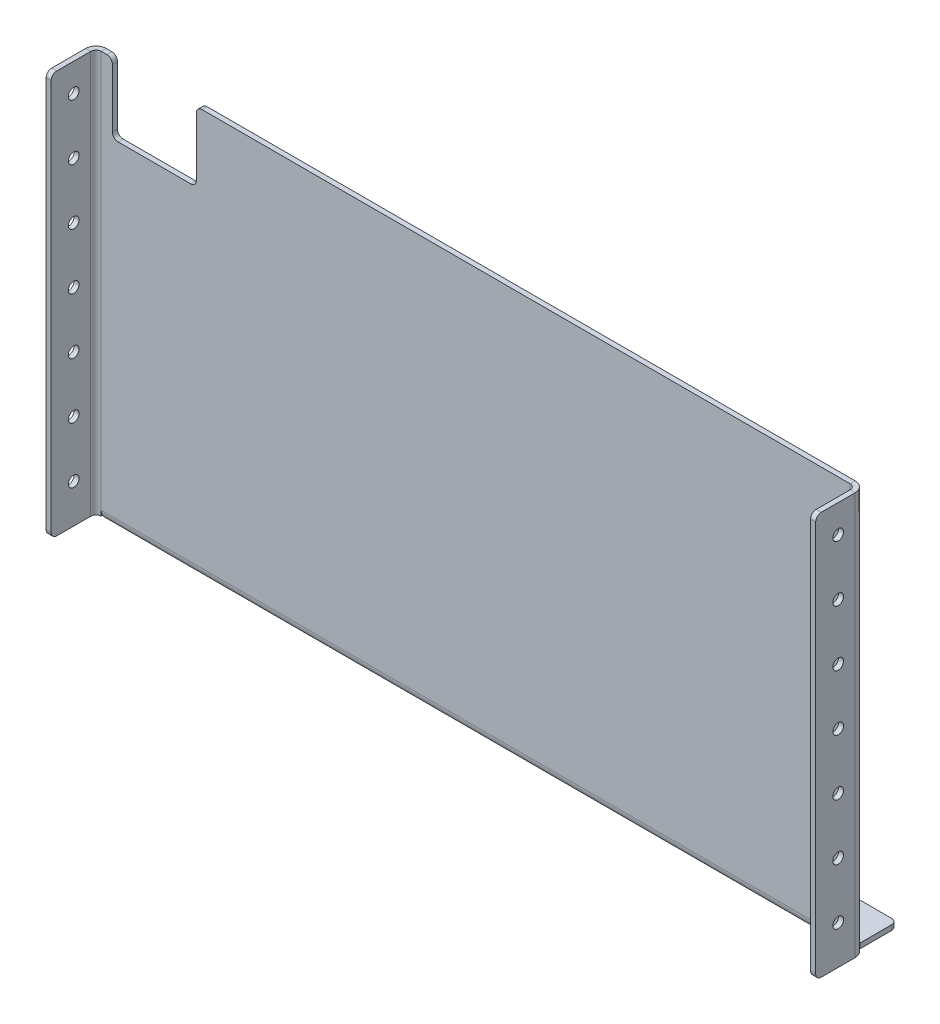
from build123d import *

# Parameters (mm, degrees)
SKETCH1_W                       = 344.6280001
SKETCH1_H                       = 182.714000078
BASE_FLANGE1_DEPTH              = 2.286
EDGE_FLANGE1_STRIP_W            = 13.9065
EDGE_FLANGE1_STRIP_H            = 2.286
EDGE_FLANGE1_STRIP_CUT_DEPTH    = 182.714000078
EDGE_FLANGE1_STRIP_2_W          = 13.9065
EDGE_FLANGE1_STRIP_2_H          = 2.286
EDGE_FLANGE1_STRIP_CUT_2_DEPTH  = 182.714000078
EDGE_FLANGE1_DEPTH              = 182.714000078
EDGE_FLANGE1_BEND_DEPTH         = 182.714000078
EDGE_FLANGE2_STRIP_W            = 13.9065
EDGE_FLANGE2_STRIP_H            = 2.286
EDGE_FLANGE2_STRIP_CUT_DEPTH    = 339.8655001
EDGE_FLANGE2_DEPTH              = 339.8655001
SKETCH17_W                      = 38.1
SKETCH17_H                      = 31.75
CUT_EXTRUDE1_DEPTH              = 200.412142834
FILLET1_R                       = 2.54
F_11_0_191_DIAMETER_HOLE1_D     = 4.8514
F_11_0_191_DIAMETER_HOLE1_DEPTH = 349.2000001
F_11_0_191_DIAMETER_HOLE1_TIP   = 1.457507604


# Sheet-metal steps are written as plain solids
with BuildPart() as part:
    # Sketch1 → Base-Flange1 (new body)
    with BuildSketch(Plane.XY):
        Rectangle(SKETCH1_W, SKETCH1_H)
    extrude(amount=-BASE_FLANGE1_DEPTH)

    # Edge-Flange1 strip (across the edge) → Edge-Flange1 strip cut (cut)
    with BuildSketch(Plane(origin=(172.31400005, -91.357000039, 0), x_dir=(-1, 0, 0), z_dir=(0, 1, 0))):
        with Locations((-4.572, -1.143)):
            Rectangle(EDGE_FLANGE1_STRIP_W, EDGE_FLANGE1_STRIP_H)
    extrude(amount=EDGE_FLANGE1_STRIP_CUT_DEPTH, mode=Mode.SUBTRACT)

    # Edge-Flange1 strip 2 (across the edge) → Edge-Flange1 strip cut 2 (cut)
    with BuildSketch(Plane(origin=(-172.31400005, 91.357000039, 0), x_dir=(1, 0, 0), z_dir=(0, -1, 0))):
        with Locations((-4.572, -1.143)):
            Rectangle(EDGE_FLANGE1_STRIP_2_W, EDGE_FLANGE1_STRIP_2_H)
    extrude(amount=EDGE_FLANGE1_STRIP_CUT_2_DEPTH, mode=Mode.SUBTRACT)

    # Edge-Flange1 section (across the edge) → Edge-Flange1 (add)
    with BuildSketch(Plane(origin=(172.31400005, -91.357000039, 0), x_dir=(-1, 0, 0), z_dir=(0, 1, 0))):
        with BuildLine():
            Line((-2.286, 2.38125), (-2.286, 20.32))
            Line((-2.286, 20.32), (0, 20.32))
            Line((0, 20.32), (0, 2.38125))
            ThreePointArc((0, 2.38125), (0.697451977, 0.697451977), (2.38125, 0))
            Line((2.38125, 0), (2.38125, -2.286))
            ThreePointArc((2.38125, -2.286), (-0.918994124, -0.918994124), (-2.286, 2.38125))
        make_face()
    extrude(amount=EDGE_FLANGE1_DEPTH)

    # Edge-Flange1 section 2 (across the edge) → Edge-Flange1 bend (add)
    with BuildSketch(Plane(origin=(-172.31400005, 91.357000039, 0), x_dir=(1, 0, 0), z_dir=(0, -1, 0))):
        with BuildLine():
            Line((-2.286, 2.38125), (-2.286, 20.32))
            Line((-2.286, 20.32), (0, 20.32))
            Line((0, 20.32), (0, 2.38125))
            ThreePointArc((0, 2.38125), (0.697451977, 0.697451977), (2.38125, 0))
            Line((2.38125, 0), (2.38125, -2.286))
            ThreePointArc((2.38125, -2.286), (-0.918994124, -0.918994124), (-2.286, 2.38125))
        make_face()
    extrude(amount=EDGE_FLANGE1_BEND_DEPTH)

    # Edge-Flange2 strip (across the edge) → Edge-Flange2 strip cut (cut)
    with BuildSketch(Plane(origin=(169.93275005, -91.357000039, -2.286), x_dir=(0, 1, 0), z_dir=(-1, 0, 0))):
        with Locations((-4.572, -1.143)):
            Rectangle(EDGE_FLANGE2_STRIP_W, EDGE_FLANGE2_STRIP_H)
    extrude(amount=EDGE_FLANGE2_STRIP_CUT_DEPTH, mode=Mode.SUBTRACT)

    # Edge-Flange2 section (across the edge) → Edge-Flange2 (add)
    with BuildSketch(Plane(origin=(169.93275005, -91.357000039, -2.286), x_dir=(0, 1, 0), z_dir=(-1, 0, 0))):
        with BuildLine():
            Line((-2.286, 2.38125), (-2.286, 19.05))
            Line((-2.286, 19.05), (0, 19.05))
            Line((0, 19.05), (0, 2.38125))
            ThreePointArc((0, 2.38125), (0.697451977, 0.697451977), (2.38125, 0))
            Line((2.38125, 0), (2.38125, -2.286))
            ThreePointArc((2.38125, -2.286), (-0.918994124, -0.918994124), (-2.286, 2.38125))
        make_face()
    extrude(amount=EDGE_FLANGE2_DEPTH)

    # Sketch17 → Cut-Extrude1 (cut, through all)
    with BuildSketch(Plane(origin=(0, 0, -2.286), x_dir=(-1, 0, 0), z_dir=(0, 0, -1))):
        with Locations((145.80275005, 75.482000039)):
            Rectangle(SKETCH17_W, SKETCH17_H)
    extrude(amount=-CUT_EXTRUDE1_DEPTH, mode=Mode.SUBTRACT)

    # Fillet1
    fillet1_edges = [part.edges().sort_by_distance(p)[0] for p in [
        (169.93275005, -92.500000039, -21.336),
        (-169.93275005, -92.500000039, -21.336),
        (-126.75275005, 91.357000039, -1.143),
        (-164.85275005, 91.357000039, -1.143),
        (-164.85275005, 59.607000039, -1.143),
        (-126.75275005, 59.607000039, -1.143),
        (173.45700005, -91.357000039, 20.32),
        (173.45700005, 91.357000039, 20.32),
        (-173.45700005, 91.357000039, 20.32),
        (-173.45700005, -91.357000039, 20.32),
    ]]
    fillet(fillet1_edges, radius=FILLET1_R)

    # #11 (0.191) Diameter Hole1
    with Locations(Plane.ZY.offset(174.60000005)):
        with Locations((10.080625, -73.742999961), (10.080625, 78.657000039), (10.080625, 53.257000039), (10.080625, 27.857000039), (10.080625, 2.457000039), (10.080625, -22.942999961), (10.080625, -48.342999961)):
            Hole(F_11_0_191_DIAMETER_HOLE1_D / 2, depth=F_11_0_191_DIAMETER_HOLE1_DEPTH)
            with Locations((0, 0, -(F_11_0_191_DIAMETER_HOLE1_DEPTH + F_11_0_191_DIAMETER_HOLE1_TIP / 2))):  # 118° drill point
                Cone(0, F_11_0_191_DIAMETER_HOLE1_D / 2, F_11_0_191_DIAMETER_HOLE1_TIP, mode=Mode.SUBTRACT)


solid = part.part
